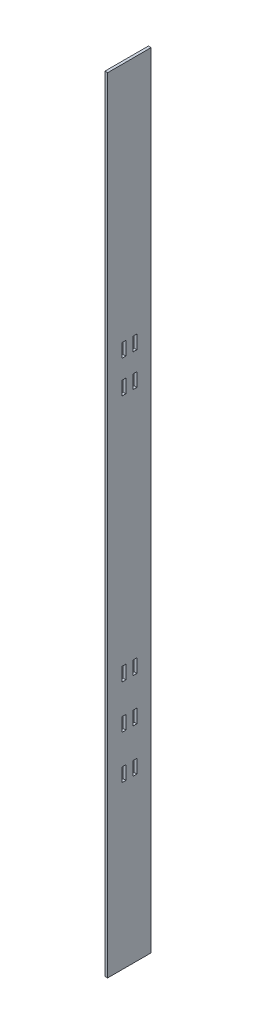
from build123d import *

# Parameters (mm, degrees)
SKETCH1_W                 = 50.8
SKETCH1_H                 = 914.4
BOSS_EXTRUDE1_DEPTH       = 3.175
SKETCH2_W                 = 4.7625
SKETCH2_H                 = 15.875
CUT_EXTRUDE1_DEPTH        = 458.916019184
LPATTERN1_COPY_1_SKETCH_W = 4.7625
LPATTERN1_COPY_1_SKETCH_H = 15.875
LPATTERN1_COPY_1_DEPTH    = 458.916019184
LPATTERN1_COPY_2_SKETCH_W = 4.7625
LPATTERN1_COPY_2_SKETCH_H = 15.875
LPATTERN1_COPY_2_DEPTH    = 458.916019184
LPATTERN1_COPY_3_SKETCH_W = 4.7625
LPATTERN1_COPY_3_SKETCH_H = 15.875
LPATTERN1_COPY_3_DEPTH    = 458.916019184
LPATTERN1_COPY_4_SKETCH_W = 4.7625
LPATTERN1_COPY_4_SKETCH_H = 15.875
LPATTERN1_COPY_4_DEPTH    = 458.916019184
LPATTERN1_COPY_5_SKETCH_W = 4.7625
LPATTERN1_COPY_5_SKETCH_H = 15.875
LPATTERN1_COPY_5_DEPTH    = 458.916019184
LPATTERN1_COPY_6_SKETCH_W = 4.7625
LPATTERN1_COPY_6_SKETCH_H = 15.875
LPATTERN1_COPY_6_DEPTH    = 458.916019184
SKETCH3_W                 = 4.7625
SKETCH3_H                 = 15.875
CUT_EXTRUDE2_DEPTH        = 458.916019184
LPATTERN2_COUNT           = 2
LPATTERN2_PITCH           = 38.1


with BuildPart() as part:
    # Sketch1 → Boss-Extrude1 (new body)
    with BuildSketch(Plane(origin=(0, 0, 0), x_dir=(0, 0, -1), z_dir=(1, 0, 0))):
        Rectangle(SKETCH1_W, SKETCH1_H)
    extrude(amount=BOSS_EXTRUDE1_DEPTH)

    # Sketch2 → Cut-Extrude1 (cut, through all)
    with BuildSketch(Plane(origin=(3.175, 0, 0), x_dir=(0, 0, -1), z_dir=(1, 0, 0))):
        with Locations((6.38125, -209.55)):
            Rectangle(SKETCH2_W, SKETCH2_H)
    cut_extrude1 = extrude(amount=-CUT_EXTRUDE1_DEPTH, mode=Mode.SUBTRACT)

    # Mirror1: Cut-Extrude1 across plane
    add(cut_extrude1.mirror(Plane.XY), mode=Mode.SUBTRACT)

    # LPattern1 copy 1 sketch → LPattern1 copy 1 (cut, through all)
    with BuildSketch(Plane(origin=(3.175, -50.8, 0), x_dir=(0, 0, 1), z_dir=(1, 0, 0))):
        with Locations((6.38125, 209.55)):
            Rectangle(LPATTERN1_COPY_1_SKETCH_W, LPATTERN1_COPY_1_SKETCH_H)
    extrude(amount=-LPATTERN1_COPY_1_DEPTH, mode=Mode.SUBTRACT)

    # LPattern1 copy 2 sketch → LPattern1 copy 2 (cut, through all)
    with BuildSketch(Plane(origin=(3.175, 50.8, 0), x_dir=(0, 0, 1), z_dir=(1, 0, 0))):
        with Locations((6.38125, 209.55)):
            Rectangle(LPATTERN1_COPY_2_SKETCH_W, LPATTERN1_COPY_2_SKETCH_H)
    extrude(amount=-LPATTERN1_COPY_2_DEPTH, mode=Mode.SUBTRACT)

    # LPattern1 copy 3 sketch → LPattern1 copy 3 (cut, through all)
    with BuildSketch(Plane(origin=(3.175, 0, 0), x_dir=(0, 0, 1), z_dir=(1, 0, 0))):
        with Locations((6.38125, 209.55)):
            Rectangle(LPATTERN1_COPY_3_SKETCH_W, LPATTERN1_COPY_3_SKETCH_H)
    extrude(amount=-LPATTERN1_COPY_3_DEPTH, mode=Mode.SUBTRACT)

    # LPattern1 copy 4 sketch → LPattern1 copy 4 (cut, through all)
    with BuildSketch(Plane(origin=(3.175, -50.8, 0), x_dir=(0, 0, -1), z_dir=(1, 0, 0))):
        with Locations((6.38125, -209.55)):
            Rectangle(LPATTERN1_COPY_4_SKETCH_W, LPATTERN1_COPY_4_SKETCH_H)
    extrude(amount=-LPATTERN1_COPY_4_DEPTH, mode=Mode.SUBTRACT)

    # LPattern1 copy 5 sketch → LPattern1 copy 5 (cut, through all)
    with BuildSketch(Plane(origin=(3.175, 50.8, 0), x_dir=(0, 0, -1), z_dir=(1, 0, 0))):
        with Locations((6.38125, -209.55)):
            Rectangle(LPATTERN1_COPY_5_SKETCH_W, LPATTERN1_COPY_5_SKETCH_H)
    extrude(amount=-LPATTERN1_COPY_5_DEPTH, mode=Mode.SUBTRACT)

    # LPattern1 copy 6 sketch → LPattern1 copy 6 (cut, through all)
    with BuildSketch(Plane(origin=(3.175, 0, 0), x_dir=(0, 0, -1), z_dir=(1, 0, 0))):
        with Locations((6.38125, -209.55)):
            Rectangle(LPATTERN1_COPY_6_SKETCH_W, LPATTERN1_COPY_6_SKETCH_H)
    extrude(amount=-LPATTERN1_COPY_6_DEPTH, mode=Mode.SUBTRACT)

    # Sketch3 → Cut-Extrude2 (cut, through all)
    with BuildSketch(Plane(origin=(3.175, 0, 0), x_dir=(0, 0, -1), z_dir=(1, 0, 0))):
        with Locations((6.38125, 130.175)):
            Rectangle(SKETCH3_W, SKETCH3_H)
        with Locations((-6.38125, 130.175)):
            Rectangle(SKETCH3_W, SKETCH3_H)
    cut_extrude2 = extrude(amount=-CUT_EXTRUDE2_DEPTH, mode=Mode.SUBTRACT)

    # LPattern2: Cut-Extrude2 ×2
    with Locations(*[(0, i * LPATTERN2_PITCH, 0) for i in range(1, LPATTERN2_COUNT)]):
        add(cut_extrude2, mode=Mode.SUBTRACT)


solid = part.part
